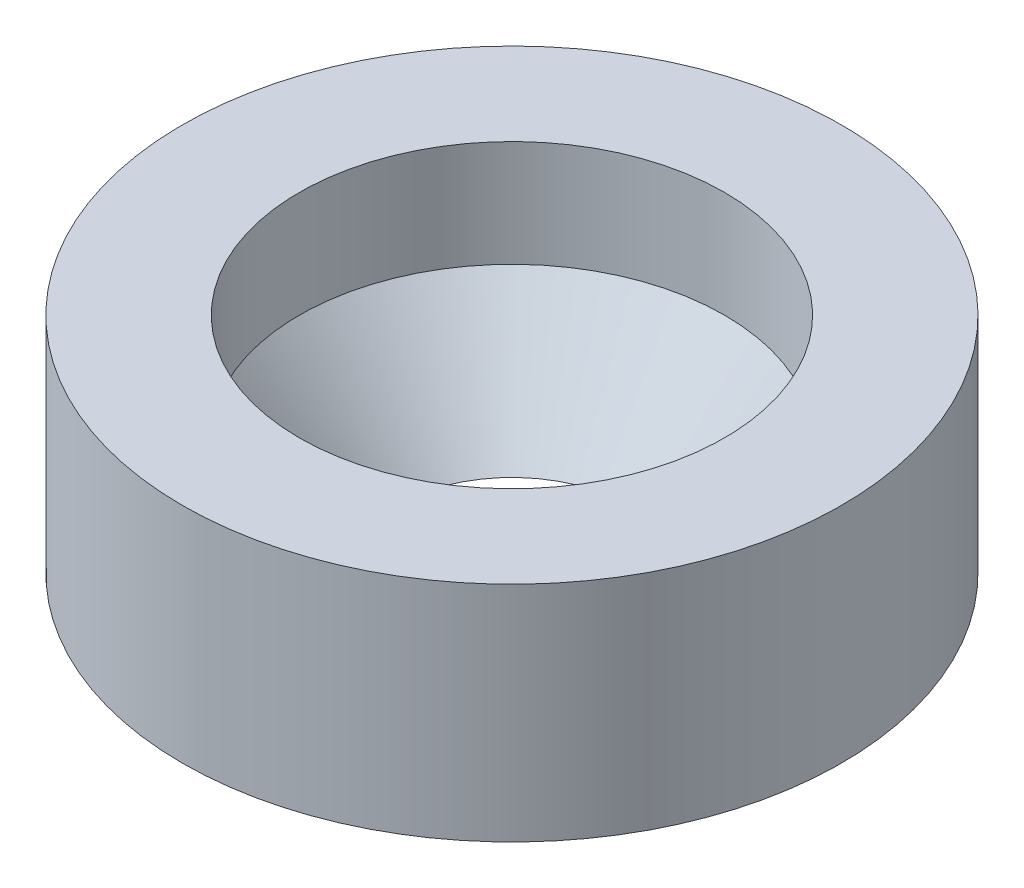
from build123d import *


with BuildPart() as part:
    # Sketch1 → Revolve1 (revolve)
    with BuildSketch(Plane(origin=(0, 0, 0), x_dir=(0, 0, -1), z_dir=(1, 0, 0))):
        Polygon((4, 2.2), (2.2, 0), (6.2, 0), (6.2, 4.2), (4, 4.2), align=None)
    revolve(axis=Axis((0, 2.2, 0), (0, -1, 0)))


solid = part.part
